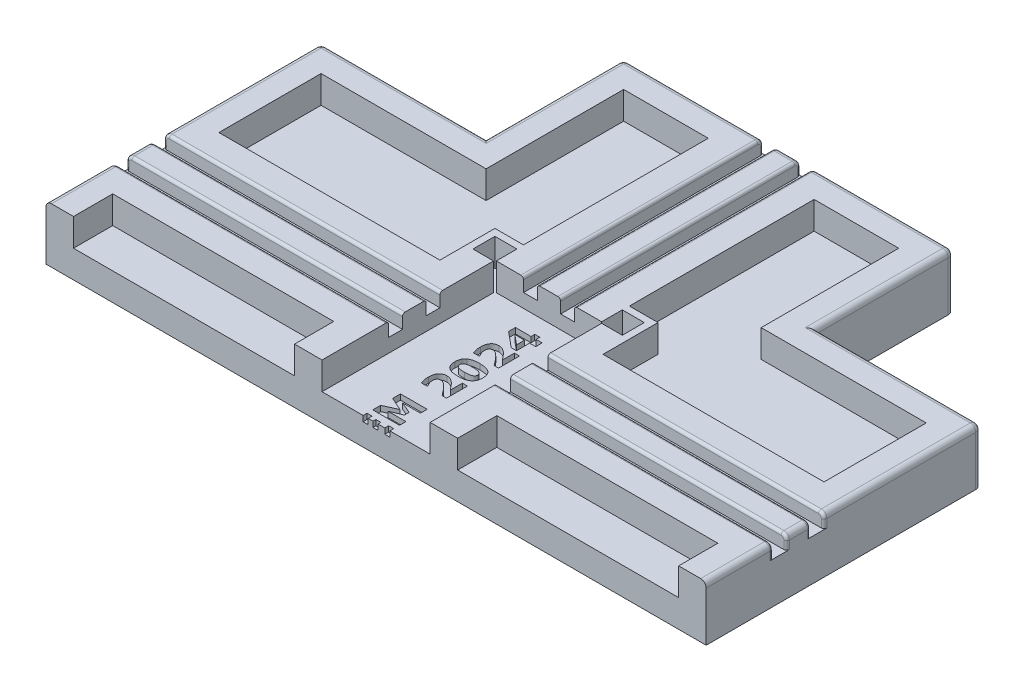
from build123d import *

# Parameters (mm, degrees)
SKETCH1_W                                  = 240
SKETCH1_H                                  = 200
BOSS_EXTRUDE1_DEPTH                        = 20
SKETCH7_W                                  = 120
SKETCH7_H                                  = 50
BOSS_EXTRUDE6_DEPTH                        = 20
FILLET1_R                                  = 2
SKETCH2_W                                  = 39.3
SKETCH2_H                                  = 125.7
CUT_EXTRUDE1_DEPTH                         = 10
CUT_EXTRUDE3_DEPTH                         = 5
MIRROR4_AT_THE_SECOND_PLANE_COPY_1_DEPTH   = 5
SKETCH11_W                                 = 104.748042719
SKETCH11_H                                 = 5
CUT_EXTRUDE4_DEPTH                         = 5
MIRROR6_AT_THE_SECOND_PLANE_COPY_1_SKETC_W = 104.748042719
MIRROR6_AT_THE_SECOND_PLANE_COPY_1_SKETC_H = 5
MIRROR6_AT_THE_SECOND_PLANE_COPY_1_DEPTH   = 5
SHELL1_START                               = 10
SHELL1_OUTLINE_W                           = 80.35
SHELL1_OUTLINE_H                           = 28.5
SHELL1_DEPTH                               = 10
FILLET3_R                                  = 1
SKETCH13_W                                 = 7.252545243
SKETCH13_H                                 = 2.335565418
SKETCH13_W_2                               = 1.720942939
SKETCH13_H_2                               = 2.581414408
CUT_EXTRUDE5_DEPTH                         = 2
CUT_EXTRUDE6_DEPTH                         = 10
MIRROR7_AT_THE_SECOND_PLANE_COPY_1_DEPTH   = 10
SKETCH15_W                                 = 266.75178719
SKETCH15_H                                 = 32.364197877
CUT_EXTRUDE7_DEPTH                         = 194.132079158


# Read off the part's stored shape, not the designer's step: Shell1
with BuildPart() as part:
    # Sketch1 → Boss-Extrude1 (new body)
    with BuildSketch(Plane(origin=(0, 0, 0), x_dir=(1, 0, 0), z_dir=(0, 1, 0))):
        Rectangle(SKETCH1_W, SKETCH1_H)
    extrude(amount=BOSS_EXTRUDE1_DEPTH)

    # Sketch7 → Boss-Extrude6 (add)
    with BuildSketch(Plane(origin=(0, 0, 0), x_dir=(1, 0, 0), z_dir=(0, 1, 0))):
        with Locations((0, 125)):
            Rectangle(SKETCH7_W, SKETCH7_H)
        with Locations((0, -125)):
            Rectangle(SKETCH7_W, SKETCH7_H)
    extrude(amount=BOSS_EXTRUDE6_DEPTH)

    # Fillet1
    fillet1_edges = [part.edges().sort_by_distance(p)[0] for p in [
        (-120, 20, 0),
        (90, 20, 100),
        (-90, 20, 100),
        (-60, 10, 150),
        (60, 10, 150),
        (-60, 20, 125),
        (0, 20, 150),
        (60, 20, 125),
        (-90, 20, -100),
        (60, 20, -125),
        (0, 20, -150),
        (60, 10, -150),
        (-60, 10, -150),
        (-60, 20, -125),
        (120, 20, 0),
        (120, 10, 100),
        (-120, 10, 100),
        (-120, 10, -100),
        (120, 10, -100),
        (90, 20, -100),
    ]]
    fillet(fillet1_edges, radius=FILLET1_R)

    # Sketch2 → Cut-Extrude1 (cut)
    with BuildSketch(Plane(origin=(0, 20, 0), x_dir=(1, 0, 0), z_dir=(0, 1, 0))):
        Rectangle(SKETCH2_W, SKETCH2_H)
    extrude(amount=-CUT_EXTRUDE1_DEPTH, mode=Mode.SUBTRACT)

    # Sketch10 → Cut-Extrude3 (cut)
    with BuildSketch(Plane(origin=(0, 20, 0), x_dir=(1, 0, 0), z_dir=(0, 1, 0))):
        Polygon((-9.25, -40.5), (-9.25, -33.162899401), (-4.25, -33.162899401), (-4.25, -40.5), (-4.25, -156.832928994), (-9.25, -156.832928994), align=None)
    cut_extrude3 = extrude(amount=-CUT_EXTRUDE3_DEPTH, mode=Mode.SUBTRACT)

    # Mirror4: Cut-Extrude3 across plane
    add(cut_extrude3.mirror(Plane(origin=(0, 0, 0), x_dir=(0, 0, 1), z_dir=(1, 0, 0))), mode=Mode.SUBTRACT)

    # Mirror4 at the second plane: Cut-Extrude3 across plane
    add(cut_extrude3.mirror(Plane.XY), mode=Mode.SUBTRACT)

    # Mirror4 at the second plane copy 1 sketc → Mirror4 at the second plane copy 1 (cut)
    with BuildSketch(Plane(origin=(0, 20, 0), x_dir=(-1, 0, 0), z_dir=(0, 1, 0))):
        Polygon((-9.25, -40.5), (-9.25, -33.162899401), (-4.25, -33.162899401), (-4.25, -40.5), (-4.25, -156.832928994), (-9.25, -156.832928994), align=None)
    extrude(amount=-MIRROR4_AT_THE_SECOND_PLANE_COPY_1_DEPTH, mode=Mode.SUBTRACT)

    # Sketch11 → Cut-Extrude4 (cut)
    with BuildSketch(Plane(origin=(0, 20, 0), x_dir=(1, 0, 0), z_dir=(0, 1, 0))):
        with Locations((-72.024021359, 26.75)):
            Rectangle(SKETCH11_W, SKETCH11_H)
        with Locations((-72.024021359, 40.35)):
            Rectangle(SKETCH11_W, SKETCH11_H)
    cut_extrude4 = extrude(amount=-CUT_EXTRUDE4_DEPTH, mode=Mode.SUBTRACT)

    # Mirror6: Cut-Extrude4 across plane
    add(cut_extrude4.mirror(Plane.XY), mode=Mode.SUBTRACT)

    # Mirror6 at the second plane: Cut-Extrude4 across plane
    add(cut_extrude4.mirror(Plane(origin=(0, 0, 0), x_dir=(0, 0, 1), z_dir=(1, 0, 0))), mode=Mode.SUBTRACT)

    # Mirror6 at the second plane copy 1 sketc → Mirror6 at the second plane copy 1 (cut)
    with BuildSketch(Plane(origin=(0, 20, 0), x_dir=(-1, 0, 0), z_dir=(0, 1, 0))):
        with Locations((-72.024021359, 26.75)):
            Rectangle(MIRROR6_AT_THE_SECOND_PLANE_COPY_1_SKETC_W, MIRROR6_AT_THE_SECOND_PLANE_COPY_1_SKETC_H)
        with Locations((-72.024021359, 40.35)):
            Rectangle(MIRROR6_AT_THE_SECOND_PLANE_COPY_1_SKETC_W, MIRROR6_AT_THE_SECOND_PLANE_COPY_1_SKETC_H)
    extrude(amount=-MIRROR6_AT_THE_SECOND_PLANE_COPY_1_DEPTH, mode=Mode.SUBTRACT)

    # Shell1 outline → Shell1 (cut)
    with BuildSketch(Plane(origin=(0, 0, 0), x_dir=(1, 0, 0), z_dir=(0, 1, 0)).offset(SHELL1_START)):
        Polygon((-29.65, 72.85), (-19.25, 72.85), (-19.25, 140), (-50, 140), (-50, 90), (-110, 90), (-110, 52.85), (-29.65, 52.85), align=None)
        Polygon((19.25, 72.85), (29.65, 72.85), (29.65, 52.85), (110, 52.85), (110, 90), (50, 90), (50, 140), (19.25, 140), align=None)
        Polygon((-110, -52.85), (-110, -90), (-50, -90), (-50, -140), (-19.25, -140), (-19.25, -72.85), (-29.65, -72.85), (-29.65, -52.85), align=None)
        with Locations((-69.825, 0)):
            Rectangle(SHELL1_OUTLINE_W, SHELL1_OUTLINE_H)
        Polygon((29.65, -72.85), (19.25, -72.85), (19.25, -140), (50, -140), (50, -90), (110, -90), (110, -52.85), (29.65, -52.85), align=None)
        with Locations((69.825, 0)):
            Rectangle(SHELL1_OUTLINE_W, SHELL1_OUTLINE_H)
    extrude(amount=SHELL1_DEPTH, mode=Mode.SUBTRACT)

    # Fillet3
    fillet3_edges = [part.edges().sort_by_distance(p)[0] for p in [
        (-4.25, 16.5, 150),
        (-4.25, 19.414213562, 149.414213562),
        (-9.25, 16.5, 150),
        (-9.25, 19.414213562, 149.414213562),
        (-4.25, 20, 105.425),
        (-9.25, 20, 105.425),
        (-9.25, 19.414213562, -149.414213562),
        (-9.25, 16.5, -150),
        (-9.25, 20, -105.425),
        (-4.25, 16.5, -150),
        (-4.25, 19.414213562, -149.414213562),
        (-4.25, 20, -105.425),
        (9.25, 16.5, 150),
        (9.25, 20, 105.425),
        (9.25, 19.414213562, 149.414213562),
        (4.25, 16.5, 150),
        (4.25, 19.414213562, 149.414213562),
        (4.25, 20, 105.425),
        (4.25, 16.5, -150),
        (4.25, 19.414213562, -149.414213562),
        (9.25, 19.414213562, -149.414213562),
        (9.25, 16.5, -150),
        (4.25, 20, -105.425),
        (9.25, 20, -105.425),
        (-120, 16.5, -24.25),
        (-120, 16.5, -29.25),
        (-119.414213562, 19.414213562, -24.25),
        (-119.414213562, 19.414213562, -29.25),
        (-68.825, 20, -24.25),
        (-68.825, 20, -29.25),
        (-120, 16.5, -37.85),
        (-120, 16.5, -42.85),
        (-68.825, 20, -37.85),
        (-68.825, 20, -42.85),
        (-119.414213562, 19.414213562, -37.85),
        (-119.414213562, 19.414213562, -42.85),
        (68.825, 20, -29.25),
        (119.414213562, 19.414213562, -29.25),
        (119.414213562, 19.414213562, -24.25),
        (68.825, 20, -24.25),
        (120, 16.5, -29.25),
        (120, 16.5, -24.25),
        (68.825, 20, -42.85),
        (119.414213562, 19.414213562, -42.85),
        (119.414213562, 19.414213562, -37.85),
        (68.825, 20, -37.85),
        (120, 16.5, -42.85),
        (120, 16.5, -37.85),
        (-120, 16.5, 29.25),
        (-120, 16.5, 24.25),
        (-68.825, 20, 29.25),
        (-119.414213562, 19.414213562, 29.25),
        (-119.414213562, 19.414213562, 24.25),
        (-68.825, 20, 24.25),
        (-120, 16.5, 42.85),
        (-120, 16.5, 37.85),
        (-68.825, 20, 42.85),
        (-119.414213562, 19.414213562, 42.85),
        (-119.414213562, 19.414213562, 37.85),
        (-68.825, 20, 37.85),
        (120, 16.5, 24.25),
        (120, 16.5, 29.25),
        (119.414213562, 19.414213562, 24.25),
        (119.414213562, 19.414213562, 29.25),
        (68.825, 20, 24.25),
        (68.825, 20, 29.25),
        (120, 16.5, 37.85),
        (120, 16.5, 42.85),
        (68.825, 20, 37.85),
        (68.825, 20, 42.85),
        (119.414213562, 19.414213562, 37.85),
        (119.414213562, 19.414213562, 42.85),
    ]]
    fillet(fillet3_edges, radius=FILLET3_R)

    # Sketch13 → Cut-Extrude5 (cut)
    # profile 1 of 12: a face of its own
    with BuildSketch(Plane(origin=(0, 10, 0), x_dir=(1, 0, 0), z_dir=(0, 1, 0))):
        Polygon((2.787359078, 56.729654742), (2.787359078, 55.37748529), (5, 55.37748529), (5, 53.041919872), (2.787359078, 53.041919872), (2.787359078, 48.247864542), (0.880108701, 48.247864542), (-4.711035156, 52.886343558), (-4.711035156, 55.37748529), (0.943491644, 55.37748529), (0.943491644, 56.729654742), align=None)
        Polygon((0.943491644, 53.041919872), (-2.596349692, 53.041919872), (0.943491644, 50.110938929), align=None, mode=Mode.SUBTRACT)
    # profile 2 of 12: a face of its own
    with BuildSketch(Plane(origin=(0, 10, 0), x_dir=(1, 0, 0), z_dir=(0, 1, 0))):
        with BuildLine():
            Line((5, 47.141544081), (5, 39.520225351))
            Line((5, 39.520225351), (3.409664338, 39.520225351))
            add(Edge.make_bspline(
                [(3.409664338, 39.520225351), (3.190599668, 39.81675512), (2.747057383, 40.417141716), (2.167094132, 41.14339637), (1.704390868, 41.703253096), (1.381972101, 42.083056551), (1.083256561, 42.417759603), (0.887687077, 42.622007507), (0.79559811, 42.718182933)],
                knots=[0, 0, 0, 0, 1.605452287, 3.25057426, 4.046675402, 4.768563423, 5.420146126, 6, 6, 6, 6], degree=3))
            add(Edge.make_bspline(
                [(0.79559811, 42.718182933), (0.732570292, 42.782561984), (0.609352585, 42.908421315), (0.423765416, 43.085974145), (0.244476812, 43.249198615), (0.074088064, 43.400664381), (-0.092796487, 43.534082219), (-0.252790737, 43.654099684), (-0.406497488, 43.759962438), (-0.599845109, 43.881290453), (-0.837875375, 44.00401532), (-1.125540586, 44.112139625), (-1.412736444, 44.178491494), (-1.604945873, 44.187117789), (-1.699385013, 44.191356186)],
                knots=[0, 0, 0, 0, 1.090093853, 2.131104457, 3.107135244, 4.023908394, 4.888948297, 5.691514549, 6.4435893, 7.146498757, 8.452673016, 9.675803408, 10.85804184, 12, 12, 12, 12], degree=3))
            add(Edge.make_bspline(
                [(-1.699385013, 44.191356186), (-1.754483363, 44.189605987), (-1.861179083, 44.186216799), (-2.017224671, 44.167846758), (-2.162681909, 44.132103765), (-2.300488192, 44.087839319), (-2.42643972, 44.024206924), (-2.544199113, 43.950411254), (-2.650531499, 43.859818439), (-2.749307162, 43.758726543), (-2.834556733, 43.642742478), (-2.911599654, 43.517157005), (-2.971430142, 43.377241787), (-3.024398474, 43.226819474), (-3.063653395, 43.063897589), (-3.092633036, 42.889340485), (-3.109905835, 42.703165878), (-3.111960528, 42.574807759), (-3.113016713, 42.508827152)],
                knots=[0, 0, 0, 0, 1.058578686, 2.049894692, 3.010224385, 3.931750511, 4.822578239, 5.71281177, 6.594427321, 7.498813824, 8.420995957, 9.353043897, 10.321837571, 11.3367408, 12.413304787, 13.535187771, 14.732999458, 16, 16, 16, 16], degree=3))
            add(Edge.make_bspline(
                [(-3.113016713, 42.508827152), (-3.110052719, 42.405568465), (-3.104041103, 42.196137688), (-3.053985994, 41.878413923), (-2.980602684, 41.552282773), (-2.873221808, 41.222921491), (-2.74714341, 40.895094854), (-2.596251992, 40.578640505), (-2.438170844, 40.269132893), (-2.314289691, 40.074405983), (-2.252545243, 39.977350819)],
                knots=[0, 0, 0, 0, 0.914703558, 1.855215137, 2.844920106, 3.875005138, 4.922433174, 5.955639304, 6.981056277, 8, 8, 8, 8], degree=3))
            Line((-2.252545243, 39.977350819), (-2.252545243, 39.766074342))
            Line((-2.252545243, 39.766074342), (-4.363389317, 39.766074342))
            add(Edge.make_bspline(
                [(-4.363389317, 39.766074342), (-4.396975153, 39.85152697), (-4.470639347, 40.038951181), (-4.568658946, 40.352153969), (-4.66491051, 40.720660415), (-4.763825821, 41.132864511), (-4.849735205, 41.573321973), (-4.910075419, 42.024211578), (-4.95119256, 42.474770211), (-4.954991729, 42.775713815), (-4.956884148, 42.92561802)],
                knots=[0, 0, 0, 0, 0.681686624, 1.495150967, 2.435076171, 3.509887788, 4.642826517, 5.765734475, 6.887081194, 8, 8, 8, 8], degree=3))
            add(Edge.make_bspline(
                [(-4.956884148, 42.92561802), (-4.954912362, 43.072306092), (-4.951074185, 43.357841566), (-4.914531776, 43.772464491), (-4.853049644, 44.160650299), (-4.769612134, 44.521836328), (-4.662431161, 44.856562797), (-4.529987596, 45.163893905), (-4.371768891, 45.443672956), (-4.191325, 45.69718541), (-3.986517109, 45.920499957), (-3.762299213, 46.116633841), (-3.516918106, 46.283180062), (-3.250583577, 46.417510178), (-2.964907945, 46.521931142), (-2.659732708, 46.596780352), (-2.333869778, 46.641015432), (-2.109911454, 46.646854566), (-1.995172081, 46.649846099)],
                knots=[0, 0, 0, 0, 1.302669921, 2.535710425, 3.693104205, 4.791067539, 5.825099944, 6.810730835, 7.758000335, 8.67487823, 9.568447078, 10.443087854, 11.315285082, 12.19521531, 13.085757283, 14.011200708, 14.981089066, 16, 16, 16, 16], degree=3))
            add(Edge.make_bspline(
                [(-1.995172081, 46.649846099), (-1.918295051, 46.648245135), (-1.764899121, 46.645050664), (-1.536586701, 46.623146341), (-1.311198259, 46.589276583), (-1.089189633, 46.538876948), (-0.870129482, 46.472993238), (-0.653296175, 46.39436831), (-0.439122967, 46.302496277), (-0.229338943, 46.193054838), (-0.018163961, 46.072147599), (0.191952814, 45.932794317), (0.405837655, 45.781094454), (0.620958688, 45.614342324), (0.835471411, 45.430057751), (1.055741697, 45.23549192), (1.273520634, 45.021368665), (1.417594688, 44.872241147), (1.490889788, 44.796375188)],
                knots=[0, 0, 0, 0, 0.907170522, 1.810115022, 2.704515666, 3.595334857, 4.494160497, 5.402400165, 6.316123003, 7.242010315, 8.19323076, 9.186549597, 10.215937183, 11.28746875, 12.397107329, 13.552885457, 14.755074217, 16, 16, 16, 16], degree=3))
            add(Edge.make_bspline(
                [(1.490889788, 44.796375188), (1.669671754, 44.600991906), (2.021428479, 44.216571794), (2.422503942, 43.720261203), (2.710127438, 43.347225494), (2.892573427, 43.11547907), (3.035611297, 42.923413887), (3.11966375, 42.809753418), (3.156132565, 42.760438229)],
                knots=[0, 0, 0, 0, 1.811045763, 3.563265038, 4.362127914, 5.033096026, 5.580478129, 6, 6, 6, 6], degree=3))
            Line((3.156132565, 42.760438229), (3.156132565, 47.141544081))
            Line((3.156132565, 47.141544081), (5, 47.141544081))
        make_face()
    # profile 3 of 12: a face of its own
    with BuildSketch(Plane(origin=(0, 10, 0), x_dir=(1, 0, 0), z_dir=(0, 1, 0))):
        with BuildLine():
            add(Edge.make_bspline(
                [(0.138720336, 37.553433421), (0.339837036, 37.551198694), (0.731017162, 37.546852061), (1.301575539, 37.503210957), (1.839727263, 37.435290008), (2.344336806, 37.340402007), (2.812295891, 37.218717557), (3.235819492, 37.059739443), (3.620265586, 36.877229499), (3.845547684, 36.720963882), (3.955141787, 36.64494457)],
                knots=[0, 0, 0, 0, 1.210994604, 2.355433537, 3.443919748, 4.476135166, 5.446013627, 6.351277171, 7.197937607, 8, 8, 8, 8], degree=3))
            add(Edge.make_bspline(
                [(3.955141787, 36.64494457), (4.057367971, 36.5617232), (4.260610648, 36.396265258), (4.524020765, 36.101981434), (4.745368417, 35.772676286), (4.897303004, 35.472877401), (4.999247268, 35.217133399), (5.063592063, 35.011802969), (5.122267484, 34.796985151), (5.167723638, 34.570405454), (5.201934481, 34.333084121), (5.226664862, 34.085073274), (5.242295446, 33.825562266), (5.244648027, 33.648682389), (5.245848991, 33.558387312)],
                knots=[0, 0, 0, 0, 1.363120718, 2.710110989, 4.070537742, 5.460816644, 6.180869889, 6.918733188, 7.687278466, 8.485437086, 9.309407483, 10.168795045, 11.065191617, 12, 12, 12, 12], degree=3))
            add(Edge.make_bspline(
                [(5.245848991, 33.558387312), (5.241905689, 33.384062955), (5.234297073, 33.047703496), (5.173081199, 32.562988904), (5.069699732, 32.118069919), (4.926806373, 31.711596248), (4.739854178, 31.34454147), (4.516760058, 31.013155063), (4.251279595, 30.717979546), (4.045332533, 30.554230832), (3.94169692, 30.471830054)],
                knots=[0, 0, 0, 0, 1.200851745, 2.317047666, 3.359233085, 4.342911255, 5.278031965, 6.189548012, 7.088953741, 8, 8, 8, 8], degree=3))
            add(Edge.make_bspline(
                [(3.94169692, 30.471830054), (3.829424185, 30.3947628), (3.600170882, 30.2373967), (3.214838014, 30.049115343), (2.792701976, 29.89168932), (2.331256748, 29.768085058), (1.834031119, 29.675388633), (1.301418942, 29.61187027), (0.734794995, 29.570336966), (0.344952566, 29.565716964), (0.144482422, 29.563341204)],
                knots=[0, 0, 0, 0, 0.822750793, 1.680001256, 2.58557045, 3.544707477, 4.565467581, 5.642347189, 6.787615291, 8, 8, 8, 8], degree=3))
            add(Edge.make_bspline(
                [(0.144482422, 29.563341204), (-0.061754837, 29.565532126), (-0.459970452, 29.569762495), (-1.036345286, 29.613069323), (-1.570746564, 29.680774054), (-2.065452333, 29.775711056), (-2.521358164, 29.900947264), (-2.938473361, 30.06222162), (-3.323134476, 30.249194002), (-3.55325365, 30.406272972), (-3.666176943, 30.483354226)],
                knots=[0, 0, 0, 0, 1.242237956, 2.39858964, 3.479780431, 4.485821505, 5.430991799, 6.32348679, 7.177307181, 8, 8, 8, 8], degree=3))
            add(Edge.make_bspline(
                [(-3.666176943, 30.483354226), (-3.769193286, 30.566416838), (-3.974708441, 30.732124775), (-4.238285133, 31.029639616), (-4.461065672, 31.362253167), (-4.645070962, 31.729678272), (-4.784115122, 32.135791847), (-4.885860052, 32.577168574), (-4.944671996, 33.056148657), (-4.952723667, 33.387282789), (-4.956884148, 33.558387312)],
                knots=[0, 0, 0, 0, 0.915406887, 1.826214983, 2.74012738, 3.682217607, 4.664024873, 5.706462388, 6.814877053, 8, 8, 8, 8], degree=3))
            add(Edge.make_bspline(
                [(-4.956884148, 33.558387312), (-4.955682618, 33.64868302), (-4.953320425, 33.826203271), (-4.937576888, 34.086978277), (-4.913381513, 34.337057391), (-4.877300412, 34.575699285), (-4.828262853, 34.80214551), (-4.773499009, 35.018778584), (-4.706561244, 35.224310597), (-4.601886899, 35.480626422), (-4.447267393, 35.781827029), (-4.217150947, 36.109134402), (-3.948246131, 36.405401156), (-3.739143401, 36.569659884), (-3.633525124, 36.652627351)],
                knots=[0, 0, 0, 0, 0.927772364, 1.823989051, 2.683453821, 3.508702832, 4.302191287, 5.063276402, 5.803871599, 6.520953588, 7.906777029, 9.27188215, 10.622021304, 12, 12, 12, 12], degree=3))
            add(Edge.make_bspline(
                [(-3.633525124, 36.652627351), (-3.521300204, 36.729189524), (-3.292789343, 36.885084383), (-2.908970475, 37.068290297), (-2.492360426, 37.225455121), (-2.036263275, 37.346342452), (-1.54437137, 37.439204828), (-1.015826808, 37.505677425), (-0.450933502, 37.546286922), (-0.061742996, 37.551003841), (0.138720336, 37.553433421)],
                knots=[0, 0, 0, 0, 0.826423845, 1.682753026, 2.582377666, 3.535958882, 4.552416628, 5.629628825, 6.779074777, 8, 8, 8, 8], degree=3))
        make_face()
        with BuildLine():
            add(Edge.make_bspline(
                [(0.138720336, 35.094943508), (-0.002794049, 35.093990238), (-0.275052116, 35.092156251), (-0.667644343, 35.074004214), (-1.028464631, 35.048543297), (-1.357952356, 35.010483072), (-1.656192237, 34.961169576), (-1.923473104, 34.900935006), (-2.158488294, 34.828227196), (-2.363936988, 34.745989678), (-2.54162794, 34.64913888), (-2.69467252, 34.537908006), (-2.823572221, 34.410664927), (-2.931286275, 34.270097317), (-3.011274034, 34.111739825), (-3.072443859, 33.941187009), (-3.106785969, 33.754382189), (-3.110895684, 33.625106618), (-3.113016713, 33.558387312)],
                knots=[0, 0, 0, 0, 1.684598718, 3.240982106, 4.677870026, 5.990101975, 7.188004416, 8.275163324, 9.249099904, 10.113910365, 10.905306099, 11.652292794, 12.358339015, 13.054983843, 13.750418457, 14.461547751, 15.206002611, 16, 16, 16, 16], degree=3))
            add(Edge.make_bspline(
                [(-3.113016713, 33.558387312), (-3.110895681, 33.491668012), (-3.106785962, 33.362392453), (-3.072443884, 33.175587552), (-3.011273943, 33.005035023), (-2.931286606, 32.84667649), (-2.823570979, 32.706112772), (-2.694677343, 32.578854684), (-2.541608299, 32.467684345), (-2.363496496, 32.37029911), (-2.157013742, 32.289020864), (-1.921590867, 32.215742751), (-1.654258135, 32.155647372), (-1.355414385, 32.106122047), (-1.024612933, 32.068276855), (-0.661244964, 32.04269777), (-0.266085327, 32.024665897), (0.008090715, 32.022799039), (0.150244508, 32.021831116)],
                knots=[0, 0, 0, 0, 0.791766581, 1.534129826, 2.243261137, 2.936741863, 3.631429404, 4.335491923, 5.08037989, 5.869552125, 6.738971147, 7.710171362, 8.794275798, 9.988812621, 11.304907075, 12.745337551, 14.312534512, 16, 16, 16, 16], degree=3))
            add(Edge.make_bspline(
                [(0.150244508, 32.021831116), (0.289201434, 32.022765136), (0.556986265, 32.024565091), (0.943773412, 32.043063349), (1.30096878, 32.067483158), (1.627502144, 32.109075315), (1.924420257, 32.156514098), (2.190195476, 32.220950105), (2.427221865, 32.292197549), (2.635687527, 32.376524358), (2.816464841, 32.475577579), (2.974492505, 32.586386469), (3.106149375, 32.714997304), (3.215613674, 32.855867424), (3.298888327, 33.012083539), (3.358752163, 33.181622444), (3.396338685, 33.365314373), (3.400067537, 33.492898418), (3.401981557, 33.558387312)],
                knots=[0, 0, 0, 0, 1.658832269, 3.196746878, 4.622488866, 5.931787449, 7.125569234, 8.210133994, 9.194149195, 10.078471196, 10.889203548, 11.650697572, 12.375032472, 13.07829054, 13.77251817, 14.478471121, 15.218999177, 16, 16, 16, 16], degree=3))
            add(Edge.make_bspline(
                [(3.401981557, 33.558387312), (3.400068186, 33.623876875), (3.3963406, 33.751462223), (3.358745104, 33.935144911), (3.298913291, 34.10471679), (3.215521541, 34.260812329), (3.106775331, 34.40178813), (2.97377315, 34.528364287), (2.816557237, 34.639341559), (2.635707586, 34.738476019), (2.42683161, 34.821967534), (2.190341985, 34.897522561), (1.921851262, 34.956560743), (1.624132619, 35.009519497), (1.295502071, 35.045529443), (0.936895825, 35.074962985), (0.547988509, 35.091838226), (0.278306115, 35.093884415), (0.138720336, 35.094943508)],
                knots=[0, 0, 0, 0, 0.778971247, 1.517574904, 2.221693305, 2.914116855, 3.615547377, 4.332711038, 5.092226179, 5.900851692, 6.782875619, 7.766611013, 8.854037796, 10.053520173, 11.366075456, 12.788704916, 14.337855446, 16, 16, 16, 16], degree=3))
        make_face(mode=Mode.SUBTRACT)
    # profile 4 of 12: a face of its own
    with BuildSketch(Plane(origin=(0, 10, 0), x_dir=(1, 0, 0), z_dir=(0, 1, 0))):
        with BuildLine():
            Line((5, 28.211171751), (5, 20.589853021))
            Line((5, 20.589853021), (3.409664338, 20.589853021))
            add(Edge.make_bspline(
                [(3.409664338, 20.589853021), (3.190599668, 20.88638279), (2.747057383, 21.486769386), (2.167094132, 22.21302404), (1.704390868, 22.772880767), (1.381972101, 23.152684221), (1.083256561, 23.487387273), (0.887687077, 23.691635177), (0.79559811, 23.787810603)],
                knots=[0, 0, 0, 0, 1.605452287, 3.25057426, 4.046675402, 4.768563423, 5.420146126, 6, 6, 6, 6], degree=3))
            add(Edge.make_bspline(
                [(0.79559811, 23.787810603), (0.732570292, 23.852189654), (0.609352585, 23.978048985), (0.423765416, 24.155601815), (0.244476812, 24.318826285), (0.074088064, 24.470292051), (-0.092796487, 24.60370989), (-0.252790737, 24.723727355), (-0.406497488, 24.829590108), (-0.599845109, 24.950918123), (-0.837875375, 25.07364299), (-1.125540586, 25.181767295), (-1.412736444, 25.248119164), (-1.604945873, 25.256745459), (-1.699385013, 25.260983856)],
                knots=[0, 0, 0, 0, 1.090093853, 2.131104457, 3.107135244, 4.023908394, 4.888948297, 5.691514549, 6.4435893, 7.146498757, 8.452673016, 9.675803408, 10.85804184, 12, 12, 12, 12], degree=3))
            add(Edge.make_bspline(
                [(-1.699385013, 25.260983856), (-1.754483363, 25.259233658), (-1.861179083, 25.25584447), (-2.017224671, 25.237474428), (-2.162681909, 25.201731435), (-2.300488192, 25.157466989), (-2.42643972, 25.093834595), (-2.544199113, 25.020038924), (-2.650531499, 24.929446109), (-2.749307162, 24.828354213), (-2.834556733, 24.712370148), (-2.911599654, 24.586784675), (-2.971430142, 24.446869457), (-3.024398474, 24.296447144), (-3.063653395, 24.133525259), (-3.092633036, 23.958968155), (-3.109905835, 23.772793548), (-3.111960528, 23.644435429), (-3.113016713, 23.578454822)],
                knots=[0, 0, 0, 0, 1.058578686, 2.049894692, 3.010224385, 3.931750511, 4.822578239, 5.71281177, 6.594427321, 7.498813824, 8.420995957, 9.353043897, 10.321837571, 11.3367408, 12.413304787, 13.535187771, 14.732999458, 16, 16, 16, 16], degree=3))
            add(Edge.make_bspline(
                [(-3.113016713, 23.578454822), (-3.110052719, 23.475196136), (-3.104041103, 23.265765358), (-3.053985994, 22.948041593), (-2.980602684, 22.621910443), (-2.873221808, 22.292549161), (-2.74714341, 21.964722525), (-2.596251992, 21.648268175), (-2.438170844, 21.338760563), (-2.314289691, 21.144033653), (-2.252545243, 21.046978489)],
                knots=[0, 0, 0, 0, 0.914703558, 1.855215137, 2.844920106, 3.875005138, 4.922433174, 5.955639304, 6.981056277, 8, 8, 8, 8], degree=3))
            Line((-2.252545243, 21.046978489), (-2.252545243, 20.835702012))
            Line((-2.252545243, 20.835702012), (-4.363389317, 20.835702012))
            add(Edge.make_bspline(
                [(-4.363389317, 20.835702012), (-4.396975153, 20.92115464), (-4.470639347, 21.108578851), (-4.568658946, 21.421781639), (-4.66491051, 21.790288086), (-4.763825821, 22.202492181), (-4.849735205, 22.642949643), (-4.910075419, 23.093839248), (-4.95119256, 23.544397881), (-4.954991729, 23.845341485), (-4.956884148, 23.99524569)],
                knots=[0, 0, 0, 0, 0.681686624, 1.495150967, 2.435076171, 3.509887788, 4.642826517, 5.765734475, 6.887081194, 8, 8, 8, 8], degree=3))
            add(Edge.make_bspline(
                [(-4.956884148, 23.99524569), (-4.954912362, 24.141933762), (-4.951074185, 24.427469237), (-4.914531776, 24.842092162), (-4.853049644, 25.230277969), (-4.769612134, 25.591463998), (-4.662431161, 25.926190468), (-4.529987596, 26.233521576), (-4.371768891, 26.513300626), (-4.191325, 26.76681308), (-3.986517109, 26.990127627), (-3.762299213, 27.186261512), (-3.516918106, 27.352807733), (-3.250583577, 27.487137848), (-2.964907945, 27.591558812), (-2.659732708, 27.666408023), (-2.333869778, 27.710643103), (-2.109911454, 27.716482236), (-1.995172081, 27.719473769)],
                knots=[0, 0, 0, 0, 1.302669921, 2.535710425, 3.693104205, 4.791067539, 5.825099944, 6.810730835, 7.758000335, 8.67487823, 9.568447078, 10.443087854, 11.315285082, 12.19521531, 13.085757283, 14.011200708, 14.981089066, 16, 16, 16, 16], degree=3))
            add(Edge.make_bspline(
                [(-1.995172081, 27.719473769), (-1.918295051, 27.717872805), (-1.764899121, 27.714678334), (-1.536586701, 27.692774011), (-1.311198259, 27.658904253), (-1.089189633, 27.608504619), (-0.870129482, 27.542620908), (-0.653296175, 27.46399598), (-0.439122967, 27.372123947), (-0.229338943, 27.262682508), (-0.018163961, 27.141775269), (0.191952814, 27.002421987), (0.405837655, 26.850722124), (0.620958688, 26.683969994), (0.835471411, 26.499685422), (1.055741697, 26.30511959), (1.273520634, 26.090996335), (1.417594688, 25.941868817), (1.490889788, 25.866002858)],
                knots=[0, 0, 0, 0, 0.907170522, 1.810115022, 2.704515666, 3.595334857, 4.494160497, 5.402400165, 6.316123003, 7.242010315, 8.19323076, 9.186549597, 10.215937183, 11.28746875, 12.397107329, 13.552885457, 14.755074217, 16, 16, 16, 16], degree=3))
            add(Edge.make_bspline(
                [(1.490889788, 25.866002858), (1.669671754, 25.670619576), (2.021428479, 25.286199464), (2.422503942, 24.789888873), (2.710127438, 24.416853164), (2.892573427, 24.18510674), (3.035611297, 23.993041557), (3.11966375, 23.879381088), (3.156132565, 23.830065899)],
                knots=[0, 0, 0, 0, 1.811045763, 3.563265038, 4.362127914, 5.033096026, 5.580478129, 6, 6, 6, 6], degree=3))
            Line((3.156132565, 23.830065899), (3.156132565, 28.211171751))
            Line((3.156132565, 28.211171751), (5, 28.211171751))
        make_face()
    # profile 5 of 12: a face of its own
    with BuildSketch(Plane(origin=(0, 10, 0), x_dir=(1, 0, 0), z_dir=(0, 1, 0))):
        Polygon((5, 13.583156769), (5, 11.124666856), (-1.524601746, 11.124666856), (2.664434583, 9.338420279), (2.664434583, 7.625160121), (-1.524601746, 5.838913543), (5, 5.838913543), (5, 3.503348126), (-4.711035156, 3.503348126), (-4.711035156, 6.382470298), (0.125275469, 8.549014533), (-4.711035156, 10.709796683), (-4.711035156, 13.583156769), align=None)
    # profile 6 of 12: a face of its own
    with BuildSketch(Plane(origin=(0, 10, 0), x_dir=(1, 0, 0), z_dir=(0, 1, 0))):
        Polygon((5, 1.4136317), (5, -5.593064552), (-4.711035156, -5.593064552), (-4.711035156, 1.4136317), (-2.867167722, 1.4136317), (-2.867167722, -3.134574639), (-1.146224782, -3.134574639), (-1.146224782, 1.044858213), (0.697642652, 1.044858213), (0.697642652, -3.134574639), (3.156132565, -3.134574639), (3.156132565, 1.4136317), align=None)
    # profile 7 of 12: a face of its own
    with BuildSketch(Plane(origin=(0, 10, 0), x_dir=(1, 0, 0), z_dir=(0, 1, 0))):
        with BuildLine():
            add(Edge.make_bspline(
                [(4.475650198, -7.805705474), (4.519354839, -7.923859504), (4.612512661, -8.17570855), (4.743574124, -8.583890089), (4.866671289, -9.047274178), (4.996208031, -9.552124696), (5.106381276, -10.084227717), (5.187397941, -10.625264318), (5.237323662, -11.165972628), (5.243010567, -11.526628491), (5.245848991, -11.706637515)],
                knots=[0, 0, 0, 0, 0.756485239, 1.612472169, 2.573171414, 3.635272123, 4.742182008, 5.834553763, 6.919191659, 8, 8, 8, 8], degree=3))
            add(Edge.make_bspline(
                [(5.245848991, -11.706637515), (5.241962961, -11.909112321), (5.234392087, -12.303579456), (5.17063924, -12.878829296), (5.062937634, -13.419584917), (4.916847086, -13.928231287), (4.72267015, -14.400885619), (4.491042888, -14.842463027), (4.211679163, -15.247896521), (3.893490591, -15.618759753), (3.53655883, -15.9505899), (3.145758166, -16.239699566), (2.72146993, -16.48347792), (2.264846611, -16.681095463), (1.776896349, -16.838089964), (1.255150105, -16.944841813), (0.702111097, -17.014888699), (0.322052776, -17.021601157), (0.127196165, -17.025042647)],
                knots=[0, 0, 0, 0, 1.160705024, 2.261318311, 3.313123859, 4.319096107, 5.290496718, 6.238021168, 7.172737693, 8.107230733, 9.03451477, 9.961071912, 10.888559376, 11.833805606, 12.808979065, 13.821966168, 14.883317984, 16, 16, 16, 16], degree=3))
            add(Edge.make_bspline(
                [(0.127196165, -17.025042647), (-0.058682323, -17.02067815), (-0.422730133, -17.012130168), (-0.955049114, -16.943336637), (-1.460067022, -16.832867692), (-1.937766829, -16.677677821), (-2.386372436, -16.473696921), (-2.808700267, -16.227656485), (-3.203463564, -15.935836699), (-3.565000576, -15.598836264), (-3.895700628, -15.226075236), (-4.177610929, -14.810267907), (-4.422741814, -14.363406013), (-4.616779655, -13.8775432), (-4.772219277, -13.359136807), (-4.876169413, -12.804694831), (-4.946971316, -12.216810998), (-4.953520434, -11.812500101), (-4.956884148, -11.604840667)],
                knots=[0, 0, 0, 0, 1.061573339, 2.079118747, 3.060574866, 4.011305467, 4.942696719, 5.870461571, 6.798745348, 7.740825567, 8.68941507, 9.638984161, 10.604583371, 11.595514188, 12.621960228, 13.691449096, 14.814297672, 16, 16, 16, 16], degree=3))
            add(Edge.make_bspline(
                [(-4.956884148, -11.604840667), (-4.954318925, -11.445386322), (-4.949235323, -11.129389392), (-4.919388643, -10.661251886), (-4.863951384, -10.205248288), (-4.792453594, -9.753475749), (-4.684946461, -9.294730481), (-4.534849919, -8.818874824), (-4.346707534, -8.316660693), (-4.193287983, -7.980233106), (-4.113698935, -7.805705474)],
                knots=[0, 0, 0, 0, 0.974479143, 1.931163549, 2.86485946, 3.780778834, 4.725046501, 5.741022375, 6.828116267, 8, 8, 8, 8], degree=3))
            Line((-4.113698935, -7.805705474), (-1.883771756, -7.805705474))
            Line((-1.883771756, -7.805705474), (-1.883771756, -8.091889065))
            add(Edge.make_bspline(
                [(-1.883771756, -8.091889065), (-1.906716104, -8.126531064), (-1.957410079, -8.203070203), (-2.043059993, -8.326945943), (-2.137489474, -8.476111594), (-2.284548962, -8.694884397), (-2.45960062, -8.978067997), (-2.581693909, -9.213466955), (-2.640525683, -9.326896107)],
                knots=[0, 0, 0, 0, 0.515980687, 1.140024195, 1.869947604, 2.707876564, 4.413660046, 6, 6, 6, 6], degree=3))
            add(Edge.make_bspline(
                [(-2.640525683, -9.326896107), (-2.672756546, -9.393740863), (-2.73882048, -9.530753251), (-2.823836627, -9.749019276), (-2.905177649, -9.981830174), (-2.978097, -10.22950925), (-3.037034138, -10.489919732), (-3.082413494, -10.759686706), (-3.106467195, -11.03779789), (-3.110821171, -11.225783758), (-3.113016713, -11.320577771)],
                knots=[0, 0, 0, 0, 0.861448091, 1.765719082, 2.717953576, 3.724891765, 4.761927522, 5.816719679, 6.89905606, 8, 8, 8, 8], degree=3))
            add(Edge.make_bspline(
                [(-3.113016713, -11.320577771), (-3.110164997, -11.430782772), (-3.104578279, -11.646682304), (-3.068710383, -11.963218824), (-3.004292393, -12.263584213), (-2.918860854, -12.549882667), (-2.805175217, -12.820581595), (-2.662381265, -13.075068024), (-2.499039638, -13.320076357), (-2.36711736, -13.466852812), (-2.300562624, -13.540901474)],
                knots=[0, 0, 0, 0, 1.091217493, 2.137773647, 3.148547478, 4.129133693, 5.092188092, 6.048375109, 7.015406034, 8, 8, 8, 8], degree=3))
            add(Edge.make_bspline(
                [(-2.300562624, -13.540901474), (-2.231129169, -13.608753509), (-2.090799964, -13.745886571), (-1.846186727, -13.91943259), (-1.579009792, -14.07619004), (-1.283734201, -14.208811415), (-0.962723927, -14.314570988), (-0.616833633, -14.387928819), (-0.248028071, -14.435679856), (0.006035391, -14.440927383), (0.136799641, -14.443628239)],
                knots=[0, 0, 0, 0, 0.871242595, 1.760833901, 2.686460846, 3.652134751, 4.663748384, 5.717797841, 6.825370436, 8, 8, 8, 8], degree=3))
            add(Edge.make_bspline(
                [(0.136799641, -14.443628239), (0.270078203, -14.441217619), (0.528956778, -14.436535262), (0.904701948, -14.395518364), (1.257245759, -14.329288021), (1.585144219, -14.233472949), (1.889752999, -14.11198958), (2.170660406, -13.964565335), (2.424839249, -13.78559248), (2.657673098, -13.584235453), (2.862193118, -13.352834409), (3.041867765, -13.096983341), (3.191530728, -12.813783401), (3.315763592, -12.506455713), (3.407777269, -12.172177215), (3.477785429, -11.813452581), (3.51753353, -11.428392977), (3.522401475, -11.163169785), (3.524906052, -11.026711399)],
                knots=[0, 0, 0, 0, 1.162877018, 2.258757441, 3.29433279, 4.289818334, 5.235063129, 6.152415668, 7.05144509, 7.94239879, 8.832861761, 9.739671241, 10.664582224, 11.622279774, 12.626959197, 13.685538709, 14.809200461, 16, 16, 16, 16], degree=3))
            add(Edge.make_bspline(
                [(3.524906052, -11.026711399), (3.524545414, -10.976125561), (3.523787414, -10.869802624), (3.51698298, -10.707868976), (3.511542352, -10.544994826), (3.50110347, -10.438303115), (3.496095624, -10.387119882)],
                knots=[0, 0, 0, 0, 0.947728294, 1.991965744, 3.036685378, 4, 4, 4, 4], degree=3))
            Line((3.496095624, -10.387119882), (1.435189626, -10.387119882))
            Line((1.435189626, -10.387119882), (1.435189626, -12.353911813))
            Line((1.435189626, -12.353911813), (-0.408677809, -12.353911813))
            Line((-0.408677809, -12.353911813), (-0.408677809, -7.805705474))
            Line((-0.408677809, -7.805705474), (4.475650198, -7.805705474))
        make_face()
    # profile 8 of 12: a face of its own
    with BuildSketch(Plane(origin=(0, 10, 0), x_dir=(1, 0, 0), z_dir=(0, 1, 0))):
        with Locations((1.373727378, -19.913768295)):
            Rectangle(SKETCH13_W, SKETCH13_H)
    # profile 9 of 12: a face of its own
    with BuildSketch(Plane(origin=(0, 10, 0), x_dir=(1, 0, 0), z_dir=(0, 1, 0))):
        with Locations((-4.219337174, -19.913768295)):
            Rectangle(SKETCH13_W_2, SKETCH13_H_2)
    # profile 10 of 12: a face of its own
    with BuildSketch(Plane(origin=(0, 10, 0), x_dir=(1, 0, 0), z_dir=(0, 1, 0))):
        with BuildLine():
            add(Edge.make_bspline(
                [(5.245848991, -30.773379208), (5.241556228, -30.949600555), (5.233101922, -31.296656552), (5.17328717, -31.807137753), (5.071443943, -32.296870987), (4.929457053, -32.76358831), (4.750483589, -33.205121013), (4.527408056, -33.614715808), (4.267338932, -33.994815031), (4.061606502, -34.220067298), (3.958983177, -34.332427496)],
                knots=[0, 0, 0, 0, 1.089850102, 2.146385891, 3.173869964, 4.179760968, 5.160008291, 6.115072822, 7.059761785, 8, 8, 8, 8], degree=3))
            add(Edge.make_bspline(
                [(3.958983177, -34.332427496), (3.848038568, -34.438295465), (3.624492228, -34.651612698), (3.240912088, -34.92404395), (2.819806379, -35.161121156), (2.440058042, -35.326067869), (2.118408243, -35.437370727), (1.865302565, -35.510926057), (1.602961267, -35.571890876), (1.331038558, -35.621175666), (1.050675199, -35.662875321), (0.76008365, -35.687900337), (0.460358885, -35.70657835), (0.257194686, -35.708560179), (0.154085898, -35.709565986)],
                knots=[0, 0, 0, 0, 1.326589366, 2.672993315, 4.060770367, 5.505883836, 6.25107509, 7.007321983, 7.7873399, 8.582269437, 9.400071632, 10.240855478, 11.107208546, 12, 12, 12, 12], degree=3))
            add(Edge.make_bspline(
                [(0.154085898, -35.709565986), (-0.036260272, -35.705853317), (-0.409159179, -35.698579988), (-0.954067146, -35.631518817), (-1.472101576, -35.524248732), (-1.962272567, -35.375865598), (-2.421254864, -35.182794221), (-2.847342954, -34.951680217), (-3.242424741, -34.683652344), (-3.47520079, -34.471076121), (-3.591269829, -34.365079315)],
                knots=[0, 0, 0, 0, 1.119324668, 2.1928203, 3.223958197, 4.228260008, 5.200520162, 6.147632129, 7.076354466, 8, 8, 8, 8], degree=3))
            add(Edge.make_bspline(
                [(-3.591269829, -34.365079315), (-3.696426816, -34.256022231), (-3.907914238, -34.036691095), (-4.17855444, -33.660997219), (-4.413868173, -33.249571895), (-4.610724175, -32.802820982), (-4.765892728, -32.325941651), (-4.877010675, -31.82562766), (-4.943259501, -31.303347455), (-4.952287649, -30.948354573), (-4.956884148, -30.767617122)],
                knots=[0, 0, 0, 0, 0.919195442, 1.8486482, 2.803167129, 3.793795735, 4.808307604, 5.844199062, 6.902417522, 8, 8, 8, 8], degree=3))
            add(Edge.make_bspline(
                [(-4.956884148, -30.767617122), (-4.956393428, -30.668359933), (-4.955436829, -30.474869682), (-4.94084827, -30.191814102), (-4.921289403, -29.923828157), (-4.879474294, -29.592200908), (-4.814808823, -29.204474119), (-4.7421777, -28.904822537), (-4.707193766, -28.760490591)],
                knots=[0, 0, 0, 0, 0.880714095, 1.716848845, 2.514717796, 3.264532192, 4.682418473, 6, 6, 6, 6], degree=3))
            add(Edge.make_bspline(
                [(-4.707193766, -28.760490591), (-4.664108705, -28.621612355), (-4.581310973, -28.354726269), (-4.434982607, -27.98111963), (-4.28414942, -27.652264541), (-4.186257609, -27.446632632), (-4.140588669, -27.350700282)],
                knots=[0, 0, 0, 0, 1.146660616, 2.203568899, 3.161920647, 4, 4, 4, 4], degree=3))
            Line((-4.140588669, -27.350700282), (-1.760847261, -27.350700282))
            Line((-1.760847261, -27.350700282), (-1.760847261, -27.636883873))
            add(Edge.make_bspline(
                [(-1.760847261, -27.636883873), (-1.789760882, -27.669445598), (-1.850028949, -27.737317837), (-1.943169449, -27.84646079), (-2.044289807, -27.966859077), (-2.193791638, -28.146156267), (-2.382825876, -28.396964235), (-2.52216278, -28.612309765), (-2.594428997, -28.723997382)],
                knots=[0, 0, 0, 0, 0.571444814, 1.191129738, 1.882836886, 2.634784766, 4.254652092, 6, 6, 6, 6], degree=3))
            add(Edge.make_bspline(
                [(-2.594428997, -28.723997382), (-2.664236929, -28.846886536), (-2.805685787, -29.09589163), (-2.943550161, -29.429418426), (-3.032587435, -29.709146116), (-3.077362003, -29.929392289), (-3.107853006, -30.156624515), (-3.111280534, -30.311028434), (-3.113016713, -30.389240159)],
                knots=[0, 0, 0, 0, 1.439173741, 2.916136845, 3.667290802, 4.427345131, 5.203387771, 6, 6, 6, 6], degree=3))
            add(Edge.make_bspline(
                [(-3.113016713, -30.389240159), (-3.110477824, -30.475745648), (-3.105440763, -30.647369353), (-3.07497042, -30.902187581), (-3.020147889, -31.150575186), (-2.946619655, -31.393340851), (-2.845477271, -31.627774464), (-2.718252775, -31.853674636), (-2.562057311, -32.070037457), (-2.439651919, -32.20231689), (-2.377390434, -32.269600803)],
                knots=[0, 0, 0, 0, 1.001598119, 1.9871338, 2.96553644, 3.943152672, 4.919306753, 5.914963555, 6.939446524, 8, 8, 8, 8], degree=3))
            add(Edge.make_bspline(
                [(-2.377390434, -32.269600803), (-2.309583745, -32.332034441), (-2.171025631, -32.45961311), (-1.93152049, -32.625206542), (-1.660665123, -32.770051169), (-1.360441958, -32.900067806), (-1.026703819, -33.004078191), (-0.659549693, -33.075068855), (-0.259970233, -33.119887624), (0.017588233, -33.125326369), (0.161768679, -33.128151577)],
                knots=[0, 0, 0, 0, 0.80388915, 1.642689914, 2.53299325, 3.481872775, 4.4947599, 5.577680681, 6.741702658, 8, 8, 8, 8], degree=3))
            add(Edge.make_bspline(
                [(0.161768679, -33.128151577), (0.311768837, -33.125923628), (0.599876693, -33.121644368), (1.011428999, -33.069407329), (1.386636838, -32.994288328), (1.721395513, -32.879071876), (2.020823568, -32.741957475), (2.287301408, -32.588864868), (2.521133588, -32.418332338), (2.653723475, -32.287257692), (2.71821405, -32.223504117)],
                knots=[0, 0, 0, 0, 1.290334302, 2.478367041, 3.565730986, 4.578276722, 5.517838544, 6.396912514, 7.220272109, 8, 8, 8, 8], degree=3))
            add(Edge.make_bspline(
                [(2.71821405, -32.223504117), (2.776624204, -32.15678903), (2.892154246, -32.024832576), (3.038823686, -31.808811236), (3.156499876, -31.579934787), (3.248205125, -31.341825956), (3.315689405, -31.098752861), (3.366730598, -30.856410279), (3.396189151, -30.615336617), (3.400060024, -30.45525906), (3.401981557, -30.375795292)],
                knots=[0, 0, 0, 0, 1.054325691, 2.085361559, 3.097224921, 4.110091334, 5.115626892, 6.095649915, 7.054665517, 8, 8, 8, 8], degree=3))
            add(Edge.make_bspline(
                [(3.401981557, -30.375795292), (3.399995416, -30.300167635), (3.396010997, -30.148450175), (3.367969377, -29.92183692), (3.324531763, -29.696128902), (3.260202951, -29.473850088), (3.18176618, -29.256712893), (3.091757836, -29.045457401), (2.985752349, -28.843934907), (2.905928292, -28.715220777), (2.866107583, -28.651010962)],
                knots=[0, 0, 0, 0, 0.991289386, 1.988636345, 2.989438367, 4.001683697, 5.01851186, 6.01479875, 7.009670459, 8, 8, 8, 8], degree=3))
            add(Edge.make_bspline(
                [(2.866107583, -28.651010962), (2.799086235, -28.54754028), (2.667016335, -28.343644611), (2.482727048, -28.10690862), (2.33514417, -27.932313621), (2.23417018, -27.813138173), (2.139586208, -27.707238781), (2.078704196, -27.641290482), (2.049812104, -27.60999414)],
                knots=[0, 0, 0, 0, 1.674278229, 3.299273488, 4.071081905, 4.780574956, 5.421311183, 6, 6, 6, 6], degree=3))
            Line((2.049812104, -27.60999414), (2.049812104, -27.350700282))
            Line((2.049812104, -27.350700282), (4.400743084, -27.350700282))
            add(Edge.make_bspline(
                [(4.400743084, -27.350700282), (4.453977989, -27.469107265), (4.557995254, -27.700466195), (4.710217804, -28.043257711), (4.853488894, -28.385337096), (4.925202683, -28.621478965), (4.961586095, -28.741283639)],
                knots=[0, 0, 0, 0, 1.037949104, 2.028079651, 2.999562103, 4, 4, 4, 4], degree=3))
            add(Edge.make_bspline(
                [(4.961586095, -28.741283639), (5.004421769, -28.893824294), (5.086847599, -29.1873481), (5.164067273, -29.560966602), (5.209771736, -29.869797121), (5.23105018, -30.136648007), (5.244470102, -30.442236078), (5.245371714, -30.658760047), (5.245848991, -30.773379208)],
                knots=[0, 0, 0, 0, 1.383532347, 2.662238992, 3.328886368, 4.109040656, 4.999001483, 6, 6, 6, 6], degree=3))
        make_face()
    # profile 11 of 12: a face of its own
    with BuildSketch(Plane(origin=(0, 10, 0), x_dir=(1, 0, 0), z_dir=(0, 1, 0))):
        with BuildLine():
            add(Edge.make_bspline(
                [(2.021001676, -36.938810942), (2.135834195, -36.941779245), (2.360423317, -36.947584644), (2.687160369, -37.003329886), (2.994969738, -37.09114997), (3.282415269, -37.214700456), (3.547482787, -37.370068437), (3.793917062, -37.547462735), (4.012640519, -37.757602713), (4.139226852, -37.914392754), (4.202911474, -37.993272632)],
                knots=[0, 0, 0, 0, 1.09475917, 2.141126953, 3.152168046, 4.142704369, 5.117043167, 6.078545687, 7.033330935, 8, 8, 8, 8], degree=3))
            add(Edge.make_bspline(
                [(4.202911474, -37.993272632), (4.271430436, -38.089328613), (4.40755836, -38.280164856), (4.576639788, -38.587433573), (4.713481332, -38.908937379), (4.823111743, -39.248810358), (4.903771308, -39.619354907), (4.959791089, -40.029680334), (4.994197282, -40.485748637), (4.998006227, -40.805105318), (5, -40.972270956)],
                knots=[0, 0, 0, 0, 0.900219365, 1.788482918, 2.670971805, 3.564424711, 4.510769046, 5.562163026, 6.723926581, 8, 8, 8, 8], degree=3))
            Line((5, -40.972270956), (5, -45.174752151))
            Line((5, -45.174752151), (-4.711035156, -45.174752151))
            Line((-4.711035156, -45.174752151), (-4.711035156, -41.425555034))
            add(Edge.make_bspline(
                [(-4.711035156, -41.425555034), (-4.710541486, -41.331439942), (-4.70958769, -41.149604829), (-4.705841049, -40.887095211), (-4.699877008, -40.643807445), (-4.693192491, -40.420271668), (-4.681063463, -40.216067051), (-4.668157953, -40.032247924), (-4.652477333, -39.867707729), (-4.630893633, -39.673277593), (-4.585539799, -39.443346024), (-4.510417909, -39.173669198), (-4.412392074, -38.905016505), (-4.330200075, -38.730862363), (-4.288482202, -38.642467624)],
                knots=[0, 0, 0, 0, 1.191100834, 2.301266995, 3.32247628, 4.271027234, 5.131271201, 5.911180066, 6.602939548, 7.223035301, 8.386250696, 9.563798057, 10.763466492, 12, 12, 12, 12], degree=3))
            add(Edge.make_bspline(
                [(-4.288482202, -38.642467624), (-4.24037863, -38.555082717), (-4.14649073, -38.384526039), (-3.96681891, -38.160482297), (-3.766354069, -37.969249234), (-3.540529018, -37.816186883), (-3.294523859, -37.699130329), (-3.031217773, -37.613886068), (-2.750649461, -37.563414018), (-2.558140696, -37.556803917), (-2.45998033, -37.553433421)],
                knots=[0, 0, 0, 0, 1.062471767, 2.073717987, 3.049750995, 4.008349348, 4.970663542, 5.946983296, 6.953165217, 8, 8, 8, 8], degree=3))
            add(Edge.make_bspline(
                [(-2.45998033, -37.553433421), (-2.34632125, -37.557744982), (-2.123212386, -37.56620843), (-1.799163202, -37.636330667), (-1.497547426, -37.755993777), (-1.217510903, -37.917931504), (-0.962107245, -38.123087774), (-0.737146443, -38.36942586), (-0.539239297, -38.653150081), (-0.437787245, -38.864281752), (-0.385629466, -38.972827206)],
                knots=[0, 0, 0, 0, 1.021240063, 2.004659125, 2.963527431, 3.928166968, 4.902700677, 5.896727327, 6.918681, 8, 8, 8, 8], degree=3))
            Line((-0.385629466, -38.972827206), (-0.331849999, -38.972827206))
            add(Edge.make_bspline(
                [(-0.331849999, -38.972827206), (-0.315133952, -38.896322572), (-0.282373011, -38.746384985), (-0.213507173, -38.530709186), (-0.135710337, -38.325903274), (-0.042627342, -38.133886296), (0.060108174, -37.95222046), (0.178686833, -37.784999106), (0.30692412, -37.628215042), (0.449935214, -37.485611469), (0.604749117, -37.357488018), (0.771277187, -37.24414347), (0.951207426, -37.150906864), (1.14137017, -37.070940795), (1.345153065, -37.011582244), (1.560063926, -36.970821996), (1.786533831, -36.941763667), (1.941515264, -36.939811939), (2.021001676, -36.938810942)],
                knots=[0, 0, 0, 0, 1.10181943, 2.159400495, 3.183738525, 4.183475208, 5.160528738, 6.118184526, 7.065606833, 8.008818544, 8.956240851, 9.891148262, 10.838570569, 11.80433507, 12.791067958, 13.819797808, 14.881824444, 16, 16, 16, 16], degree=3))
        make_face()
        with BuildLine():
            add(Edge.make_bspline(
                [(-2.008616947, -40.134847829), (-2.09124687, -40.140597316), (-2.261302737, -40.152430001), (-2.465096768, -40.229199103), (-2.617398636, -40.321814293), (-2.718430914, -40.417582821), (-2.802491285, -40.537481784), (-2.842505816, -40.628911056), (-2.863326331, -40.676483888)],
                knots=[0, 0, 0, 0, 1.37611365, 2.832099971, 3.575724026, 4.338646544, 5.135558161, 6, 6, 6, 6], degree=3))
            add(Edge.make_bspline(
                [(-2.863326331, -40.676483888), (-2.880469479, -40.72417013), (-2.916029188, -40.823084802), (-2.94872072, -40.98465552), (-2.971826297, -41.161780037), (-2.982379957, -41.360128266), (-2.984019117, -41.586254808), (-2.989034583, -41.849372132), (-2.990414961, -42.152857164), (-2.99020396, -42.369256934), (-2.990092217, -42.483858113)],
                knots=[0, 0, 0, 0, 0.667162118, 1.383881808, 2.166847079, 3.020689487, 3.999759839, 5.147588948, 6.489417668, 8, 8, 8, 8], degree=3))
            Line((-2.990092217, -42.483858113), (-2.990092217, -42.716262238))
            Line((-2.990092217, -42.716262238), (-0.900375791, -42.716262238))
            Line((-0.900375791, -42.716262238), (-0.900375791, -42.328281799))
            add(Edge.make_bspline(
                [(-0.900375791, -42.328281799), (-0.900847936, -42.234165701), (-0.901756934, -42.052968806), (-0.905752536, -41.792392548), (-0.910819984, -41.553515408), (-0.920304415, -41.336408066), (-0.933541808, -41.139837111), (-0.960203888, -40.965118006), (-0.996788228, -40.811145546), (-1.034375643, -40.719653209), (-1.052110715, -40.676483888)],
                knots=[0, 0, 0, 0, 1.353556646, 2.605933166, 3.748016522, 4.789499618, 5.731564706, 6.579319284, 7.329672576, 8, 8, 8, 8], degree=3))
            add(Edge.make_bspline(
                [(-1.052110715, -40.676483888), (-1.078045734, -40.62432659), (-1.126824949, -40.526227872), (-1.221120897, -40.399741201), (-1.326351499, -40.301159723), (-1.446667726, -40.235307443), (-1.574159605, -40.189253382), (-1.710236455, -40.157274444), (-1.856291435, -40.137362616), (-1.956690393, -40.1357051), (-2.008616947, -40.134847829)],
                knots=[0, 0, 0, 0, 1.185047103, 2.228865504, 3.19870776, 4.098528262, 5.002595673, 5.955169327, 6.942409244, 8, 8, 8, 8], degree=3))
        make_face(mode=Mode.SUBTRACT)
        with BuildLine():
            add(Edge.make_bspline(
                [(2.026763761, -39.520225351), (1.953023318, -39.522411502), (1.813066197, -39.52656075), (1.616130796, -39.557844442), (1.445067383, -39.613491155), (1.298621824, -39.693085665), (1.174285176, -39.801935168), (1.0706615, -39.94105928), (0.983868523, -40.11095373), (0.942352079, -40.237230881), (0.920443301, -40.303869011)],
                knots=[0, 0, 0, 0, 1.190735269, 2.259979371, 3.208234232, 4.083001629, 4.93316116, 5.855523917, 6.868331482, 8, 8, 8, 8], degree=3))
            add(Edge.make_bspline(
                [(0.920443301, -40.303869011), (0.906744847, -40.356816102), (0.877297832, -40.470634336), (0.849892481, -40.657796969), (0.834020824, -40.87213552), (0.821780201, -41.198149771), (0.823210929, -41.634925024), (0.821460992, -41.990885698), (0.820567148, -42.172705484)],
                knots=[0, 0, 0, 0, 0.524312437, 1.127093368, 1.81100824, 2.585413694, 4.255876569, 6, 6, 6, 6], degree=3))
            Line((0.820567148, -42.172705484), (0.820567148, -42.716262238))
            Line((0.820567148, -42.716262238), (3.279057061, -42.716262238))
            Line((3.279057061, -42.716262238), (3.279057061, -42.535716885))
            add(Edge.make_bspline(
                [(3.279057061, -42.535716885), (3.278974112, -42.451206672), (3.278814497, -42.288588535), (3.279912217, -42.054255856), (3.276233212, -41.83851166), (3.278151037, -41.641944513), (3.274338023, -41.463336919), (3.276045374, -41.303902128), (3.273109661, -41.162417415), (3.271730495, -41.000319704), (3.261895556, -40.813029002), (3.228612943, -40.599036272), (3.178483106, -40.393438891), (3.126331492, -40.264288854), (3.100432403, -40.200151468)],
                knots=[0, 0, 0, 0, 1.290084578, 2.482435477, 3.577096325, 4.583753231, 5.482956203, 6.303919117, 7.01744192, 7.643013823, 8.77878684, 9.876279933, 10.945336299, 12, 12, 12, 12], degree=3))
            add(Edge.make_bspline(
                [(3.100432403, -40.200151468), (3.071771625, -40.139887889), (3.017172805, -40.02508569), (2.916259015, -39.871286631), (2.794668554, -39.752871432), (2.661678362, -39.662072279), (2.515987473, -39.599481173), (2.362113362, -39.552829486), (2.197351176, -39.525972374), (2.084478576, -39.52216974), (2.026763761, -39.520225351)],
                knots=[0, 0, 0, 0, 1.176739053, 2.241689486, 3.223911615, 4.151030007, 5.066033208, 6.009243398, 6.982072299, 8, 8, 8, 8], degree=3))
        make_face(mode=Mode.SUBTRACT)
    # profile 12 of 12: a face of its own
    with BuildSketch(Plane(origin=(0, 10, 0), x_dir=(1, 0, 0), z_dir=(0, 1, 0))):
        with BuildLine():
            add(Edge.make_bspline(
                [(1.512017436, -47.510317568), (1.658117535, -47.513706434), (1.9428832, -47.520311719), (2.357411184, -47.5695508), (2.744982873, -47.656562292), (3.107029839, -47.774612183), (3.441363342, -47.930059691), (3.751964278, -48.116132586), (4.033217485, -48.341116319), (4.288224496, -48.598381297), (4.5168247, -48.887909948), (4.712363571, -49.212568176), (4.877148099, -49.568574773), (5.015348627, -49.955040345), (5.115871512, -50.3760664), (5.193849339, -50.827473253), (5.236960864, -51.311818098), (5.242825893, -51.644854467), (5.245848991, -51.816516306)],
                knots=[0, 0, 0, 0, 1.078483925, 2.102087493, 3.07563418, 4.006804974, 4.907686045, 5.792049102, 6.673413646, 7.559089302, 8.461147502, 9.390096458, 10.350078799, 11.353180003, 12.414700242, 13.541405865, 14.732730623, 16, 16, 16, 16], degree=3))
            add(Edge.make_bspline(
                [(5.245848991, -51.816516306), (5.242819772, -51.988177805), (5.236942866, -52.321213512), (5.193970738, -52.804933579), (5.115991584, -53.255099563), (5.014659113, -53.675222365), (4.87752742, -54.062007781), (4.712871176, -54.418223302), (4.51624682, -54.741586999), (4.288179492, -55.030698426), (4.033899302, -55.288346201), (3.75147891, -55.510143907), (3.443571052, -55.698318074), (3.108347061, -55.850128873), (2.74757355, -55.968687572), (2.361256189, -56.055795601), (1.948018425, -56.105122439), (1.663882602, -56.111667027), (1.517779522, -56.115032264)],
                knots=[0, 0, 0, 0, 1.269417573, 2.462761791, 3.586710223, 4.645434864, 5.654699426, 6.616309069, 7.542788968, 8.446376281, 9.33355328, 10.213474434, 11.09529141, 11.995722662, 12.928471919, 13.899049301, 14.919687896, 16, 16, 16, 16], degree=3))
            Line((1.517779522, -56.115032264), (-4.711035156, -56.115032264))
            Line((-4.711035156, -56.115032264), (-4.711035156, -53.656542351))
            Line((-4.711035156, -53.656542351), (1.387172245, -53.656542351))
            add(Edge.make_bspline(
                [(1.387172245, -53.656542351), (1.469143879, -53.654753254), (1.628192667, -53.651281887), (1.858859241, -53.633577339), (2.072848893, -53.597748315), (2.272029516, -53.55328104), (2.4547094, -53.491810495), (2.620461575, -53.416686258), (2.77098949, -53.330108084), (2.904599747, -53.227374233), (3.023312628, -53.109052565), (3.125598971, -52.974011118), (3.210086887, -52.821379119), (3.282279136, -52.653957703), (3.334269574, -52.467578025), (3.375509757, -52.265592455), (3.397699401, -52.046212521), (3.400524587, -51.894668614), (3.401981557, -51.816516306)],
                knots=[0, 0, 0, 0, 1.249777764, 2.424931999, 3.522345468, 4.554462307, 5.532762845, 6.454315708, 7.324685205, 8.173785143, 9.015675824, 9.872535868, 10.746508943, 11.66914632, 12.645058795, 13.690060112, 14.808747011, 16, 16, 16, 16], degree=3))
            add(Edge.make_bspline(
                [(3.401981557, -51.816516306), (3.400674296, -51.738979381), (3.398150748, -51.589301379), (3.374130292, -51.37303247), (3.338535545, -51.172391116), (3.287897797, -50.986899342), (3.217473982, -50.818948468), (3.135438424, -50.666383082), (3.038459421, -50.529190069), (2.923990148, -50.409636263), (2.793425817, -50.304652914), (2.645688893, -50.213790545), (2.480082864, -50.136937587), (2.295259376, -50.076535285), (2.09395566, -50.026099098), (1.874093338, -49.992230388), (1.636540145, -49.973845268), (1.472355051, -49.970528364), (1.387172245, -49.968807481)],
                knots=[0, 0, 0, 0, 1.177246587, 2.272567755, 3.300601858, 4.27032395, 5.185878586, 6.060498087, 6.896988092, 7.729228332, 8.566000887, 9.434926014, 10.357220516, 11.331999863, 12.383856098, 13.506125206, 14.706123391, 16, 16, 16, 16], degree=3))
            Line((1.387172245, -49.968807481), (-4.711035156, -49.968807481))
            Line((-4.711035156, -49.968807481), (-4.711035156, -47.510317568))
            Line((-4.711035156, -47.510317568), (1.512017436, -47.510317568))
        make_face()
    extrude(amount=-CUT_EXTRUDE5_DEPTH, mode=Mode.SUBTRACT)

    # Sketch14 → Cut-Extrude6 (cut)
    with BuildSketch(Plane(origin=(0, 20, 0), x_dir=(1, 0, 0), z_dir=(0, 1, 0))):
        Polygon((-27.15, 70.35), (-27.15, 62.35), (-19.65, 62.35), (-19.65, 62.85), (-19.15, 62.85), (-19.15, 70.35), align=None)
    cut_extrude6 = extrude(amount=-CUT_EXTRUDE6_DEPTH, mode=Mode.SUBTRACT)

    # Mirror7: Cut-Extrude6 across plane
    add(cut_extrude6.mirror(Plane(origin=(0, 0, 0), x_dir=(0, 0, 1), z_dir=(1, 0, 0))), mode=Mode.SUBTRACT)

    # Mirror7 at the second plane: Cut-Extrude6 across plane
    add(cut_extrude6.mirror(Plane.XY), mode=Mode.SUBTRACT)

    # Mirror7 at the second plane copy 1 sketc → Mirror7 at the second plane copy 1 (cut)
    with BuildSketch(Plane(origin=(0, 20, 0), x_dir=(-1, 0, 0), z_dir=(0, 1, 0))):
        Polygon((-27.15, 70.35), (-27.15, 62.35), (-19.65, 62.35), (-19.65, 62.85), (-19.15, 62.85), (-19.15, 70.35), align=None)
    extrude(amount=-MIRROR7_AT_THE_SECOND_PLANE_COPY_1_DEPTH, mode=Mode.SUBTRACT)

    # Sketch15 → Cut-Extrude7 (cut, through all)
    with BuildSketch(Plane.XY):
        with Locations((-2.402030311, 8.356505577)):
            Rectangle(SKETCH15_W, SKETCH15_H)
    extrude(amount=CUT_EXTRUDE7_DEPTH, mode=Mode.SUBTRACT)


solid = part.part
